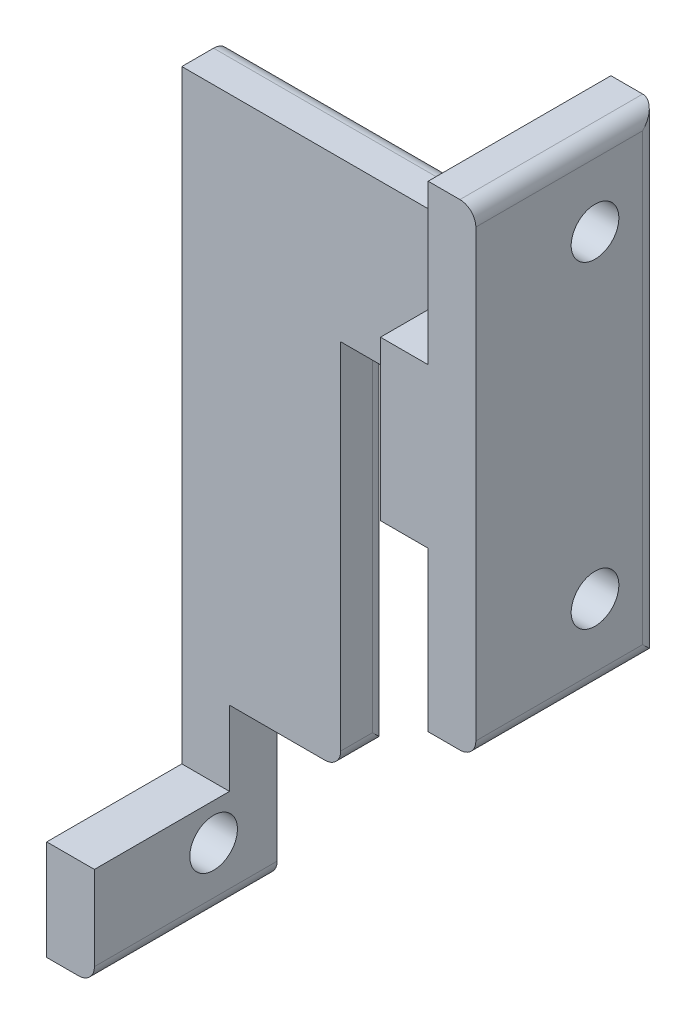
from build123d import *

# Parameters (mm, degrees)
CROQUIS1_W              = 23
CROQUIS1_H              = 33.3
SALIENTE_EXTRUIR2_DEPTH = 7
CROQUIS3_W              = 4
CROQUIS3_H              = 19
CORTAR_EXTRUIR1_DEPTH   = 42.071766458
CROQUIS7_R              = 1.5
SALIENTE_EXTRUIR3_DEPTH = 3
CROQUIS8_W              = 18
CROQUIS8_H              = 10
CROQUIS8_R              = 1.5
SALIENTE_EXTRUIR5_DEPTH = 1
SALIENTE_EXTRUIR6_START = -3
CROQUIS9_W              = 18
CROQUIS9_H              = 10
CROQUIS9_R              = 1.5
SALIENTE_EXTRUIR6_DEPTH = 3
CROQUIS10_W             = 23
CROQUIS10_H             = 10
SALIENTE_EXTRUIR7_DEPTH = 3
CROQUIS11_W             = 19
CROQUIS11_H             = 38
CORTAR_EXTRUIR5_DEPTH   = 57.449003534
CROQUIS14_W             = 7
CROQUIS14_H             = 16
CORTAR_EXTRUIR7_DEPTH   = 1
CROQUIS15_W             = 7
CROQUIS15_H             = 10
CORTAR_EXTRUIR8_DEPTH   = 58.475994989
CROQUIS17_W             = 23
CROQUIS17_H             = 10
CROQUIS17_R             = 1.5
SALIENTE_EXTRUIR8_DEPTH = 3
REDONDEO2_R             = 1
CROQUIS18_W             = 27
CROQUIS18_H             = 18.5
CORTAR_EXTRUIR10_DEPTH  = 67.516839973


with BuildPart() as part:
    # Croquis1 → Saliente-Extruir2 (new body)
    with BuildSketch(Plane(origin=(0, 0, 0), x_dir=(0, 0, -1), z_dir=(1, 0, 0))):
        with Locations((-11.5, -16.65)):
            Rectangle(CROQUIS1_W, CROQUIS1_H)
    extrude(amount=SALIENTE_EXTRUIR2_DEPTH)

    # Croquis3 → Cortar-Extruir1 (cut, through all)
    with BuildSketch(Plane(origin=(0, 0, 0), x_dir=(1, 0, 0), z_dir=(0, 1, 0))):
        with Locations((5, -12.5)):
            Rectangle(CROQUIS3_W, CROQUIS3_H)
    extrude(amount=-CORTAR_EXTRUIR1_DEPTH, mode=Mode.SUBTRACT)



with BuildPart() as body_2:
    # Croquis7 → Saliente-Extruir3 (new body)
    with BuildSketch(Plane.ZY):
        Polygon((-7, 0), (-7, -33.3), (0, -33.3), (0, -44.3), (23, -44.3), (23, -33.3), (30, -33.3), (30, 0), align=None)
        with Locations((-4, -28.3)):
            Circle(CROQUIS7_R, mode=Mode.SUBTRACT)
        with Locations((-4, -15)):
            Circle(CROQUIS7_R, mode=Mode.SUBTRACT)
        with Locations((27, -15)):
            Circle(CROQUIS7_R, mode=Mode.SUBTRACT)
        with Locations((27, -28.3)):
            Circle(CROQUIS7_R, mode=Mode.SUBTRACT)
        with Locations((19, -40.3)):
            Circle(CROQUIS7_R, mode=Mode.SUBTRACT)
        with Locations((4, -40.3)):
            Circle(CROQUIS7_R, mode=Mode.SUBTRACT)
    extrude(amount=SALIENTE_EXTRUIR3_DEPTH)


with BuildPart() as part_1:
    add(part.part)

    add(body_2.part)  # Saliente-Extruir5 merges body 2
    # Croquis8 → Saliente-Extruir5 (add)
    with BuildSketch(Plane.XY.offset(23)):
        with Locations((9, -5)):
            Rectangle(CROQUIS8_W, CROQUIS8_H)
        with Locations((15, -5)):
            Circle(CROQUIS8_R, mode=Mode.SUBTRACT)
        with Locations((3, -5)):
            Circle(CROQUIS8_R, mode=Mode.SUBTRACT)
    extrude(amount=-SALIENTE_EXTRUIR5_DEPTH)

    # Croquis9 → Saliente-Extruir6 (add)
    with BuildSketch(Plane(origin=(0, 0, 0), x_dir=(-1, 0, 0), z_dir=(0, 0, -1)).offset(SALIENTE_EXTRUIR6_START)):
        with Locations((-9, -5)):
            Rectangle(CROQUIS9_W, CROQUIS9_H)
        with Locations(Location((-15, -5, 0), (0, 0, 180))):
            Circle(CROQUIS9_R, mode=Mode.SUBTRACT)
    extrude(amount=SALIENTE_EXTRUIR6_DEPTH)

    # Croquis10 → Saliente-Extruir7 (add)
    with BuildSketch(Plane(origin=(18, 0, 0), x_dir=(0, 0, -1), z_dir=(1, 0, 0))):
        with Locations((-11.5, -5)):
            Rectangle(CROQUIS10_W, CROQUIS10_H)
    extrude(amount=SALIENTE_EXTRUIR7_DEPTH)

    # Croquis11 → Cortar-Extruir5 (cut, through all)
    with BuildSketch(Plane(origin=(3, 0, 0), x_dir=(0, 0, -1), z_dir=(1, 0, 0))):
        with Locations((-12.5, -19)):
            Rectangle(CROQUIS11_W, CROQUIS11_H)
    extrude(amount=-CORTAR_EXTRUIR5_DEPTH, mode=Mode.SUBTRACT)

    # Croquis14 → Cortar-Extruir7 (cut)
    with BuildSketch(Plane.XY.offset(23)):
        with Locations((3.5, -25.3)):
            Rectangle(CROQUIS14_W, CROQUIS14_H)
    extrude(amount=-CORTAR_EXTRUIR7_DEPTH, mode=Mode.SUBTRACT)

    # Croquis15 → Cortar-Extruir8 (cut, through all)
    with BuildSketch(Plane(origin=(0, 0, 0), x_dir=(0, 0, -1), z_dir=(1, 0, 0))):
        with Locations((-26.5, -5)):
            Rectangle(CROQUIS15_W, CROQUIS15_H)
        with Locations((3.5, -5)):
            Rectangle(CROQUIS15_W, CROQUIS15_H)
    extrude(amount=-CORTAR_EXTRUIR8_DEPTH, mode=Mode.SUBTRACT)

    # Croquis17 → Saliente-Extruir8 (add)
    # profile 1 of 3: a face of its own
    with BuildSketch(Plane(origin=(21, 0, 0), x_dir=(0, 0, -1), z_dir=(1, 0, 0))):
        with Locations((-11.5, -15)):
            Rectangle(CROQUIS17_W, CROQUIS17_H)
        with Locations((-4, -15)):
            Circle(CROQUIS17_R, mode=Mode.SUBTRACT)
        with Locations((-19, -15)):
            Circle(CROQUIS17_R, mode=Mode.SUBTRACT)
    # profile 2 of 3: a face of its own
    with BuildSketch(Plane(origin=(21, 0, 0), x_dir=(0, 0, -1), z_dir=(1, 0, 0))):
        with Locations((-11.5, -5)):
            Rectangle(CROQUIS17_W, CROQUIS17_H)
    # profile 3 of 3: a face of its own
    with BuildSketch(Plane(origin=(21, 0, 0), x_dir=(0, 0, -1), z_dir=(1, 0, 0))):
        with Locations((-11.5, 5)):
            Rectangle(CROQUIS17_W, CROQUIS17_H)
        with Locations((-19, 5)):
            Circle(CROQUIS17_R, mode=Mode.SUBTRACT)
        with Locations((-4, 5)):
            Circle(CROQUIS17_R, mode=Mode.SUBTRACT)
    extrude(amount=SALIENTE_EXTRUIR8_DEPTH)

    # Redondeo2
    # the kernel refuses this fillet: 1 mm, written as the material it takes off along each edge
    with BuildSketch(Plane(origin=(0, -44.3, 23), x_dir=(0, 0, -1), z_dir=(0, 1, 0))) as redondeo2_piece_1:
        with BuildLine():
            CenterArc((REDONDEO2_R, REDONDEO2_R), REDONDEO2_R, 180, 90)
            Line((0, REDONDEO2_R), (-REDONDEO2_R * 0.02, REDONDEO2_R))
            Line((-REDONDEO2_R * 0.02, REDONDEO2_R), (-REDONDEO2_R * 0.02, -REDONDEO2_R * 0.02))
            Line((-REDONDEO2_R * 0.02, -REDONDEO2_R * 0.02), (REDONDEO2_R, -REDONDEO2_R * 0.02))
            Line((REDONDEO2_R, -REDONDEO2_R * 0.02), (REDONDEO2_R, 0))
        make_face()
    extrude(amount=11, mode=Mode.SUBTRACT)
    with BuildSketch(Plane(origin=(0, -44.3, 0), x_dir=(0, 1, 0), z_dir=(0, 0, 1)), Plane(origin=(24, 10, 0), x_dir=(-1, 0, 0), z_dir=(0, 0, 1))) as redondeo2_piece_2:
        with BuildLine():
            CenterArc((REDONDEO2_R, REDONDEO2_R), REDONDEO2_R, 180, 90)
            Line((0, REDONDEO2_R), (-REDONDEO2_R * 0.02, REDONDEO2_R))
            Line((-REDONDEO2_R * 0.02, REDONDEO2_R), (-REDONDEO2_R * 0.02, -REDONDEO2_R * 0.02))
            Line((-REDONDEO2_R * 0.02, -REDONDEO2_R * 0.02), (REDONDEO2_R, -REDONDEO2_R * 0.02))
            Line((REDONDEO2_R, -REDONDEO2_R * 0.02), (REDONDEO2_R, 0))
        make_face()
    extrude(amount=23, mode=Mode.SUBTRACT)
    with BuildSketch(Plane(origin=(0, -10, 23), x_dir=(0, -1, 0), z_dir=(0, 0, 1)), Plane(origin=(0, -10, 0), x_dir=(-1, 0, 0), z_dir=(0, 0, -1))) as redondeo2_piece_3:
        with BuildLine():
            CenterArc((REDONDEO2_R, -REDONDEO2_R), REDONDEO2_R, 90, 90)
            Line((0, -REDONDEO2_R), (-REDONDEO2_R * 0.02, -REDONDEO2_R))
            Line((-REDONDEO2_R * 0.02, -REDONDEO2_R), (-REDONDEO2_R * 0.02, REDONDEO2_R * 0.02))
            Line((-REDONDEO2_R * 0.02, REDONDEO2_R * 0.02), (REDONDEO2_R, REDONDEO2_R * 0.02))
            Line((REDONDEO2_R, REDONDEO2_R * 0.02), (REDONDEO2_R, 0))
        make_face()
    extrude(amount=7, mode=Mode.SUBTRACT)
    with BuildSketch(Plane(origin=(0, -33.3, 23), x_dir=(0, 1, 0), z_dir=(0, 0, 1)), Plane(origin=(0, -33.3, -7), x_dir=(0, 1, 0), z_dir=(0, 0, 1))) as redondeo2_piece_4:
        with BuildLine():
            CenterArc((REDONDEO2_R, REDONDEO2_R), REDONDEO2_R, 180, 90)
            Line((0, REDONDEO2_R), (-REDONDEO2_R * 0.02, REDONDEO2_R))
            Line((-REDONDEO2_R * 0.02, REDONDEO2_R), (-REDONDEO2_R * 0.02, -REDONDEO2_R * 0.02))
            Line((-REDONDEO2_R * 0.02, -REDONDEO2_R * 0.02), (REDONDEO2_R, -REDONDEO2_R * 0.02))
            Line((REDONDEO2_R, -REDONDEO2_R * 0.02), (REDONDEO2_R, 0))
        make_face()
    extrude(amount=7, mode=Mode.SUBTRACT)
    with BuildSketch(Plane(origin=(0, -33.3, 30), x_dir=(0, 0, -1), z_dir=(0, 1, 0)), Plane(origin=(0, -10, -7), x_dir=(0, 0, 1), z_dir=(0, -1, 0))) as redondeo2_piece_5:
        with BuildLine():
            CenterArc((REDONDEO2_R, REDONDEO2_R), REDONDEO2_R, 180, 90)
            Line((0, REDONDEO2_R), (-REDONDEO2_R * 0.02, REDONDEO2_R))
            Line((-REDONDEO2_R * 0.02, REDONDEO2_R), (-REDONDEO2_R * 0.02, -REDONDEO2_R * 0.02))
            Line((-REDONDEO2_R * 0.02, -REDONDEO2_R * 0.02), (REDONDEO2_R, -REDONDEO2_R * 0.02))
            Line((REDONDEO2_R, -REDONDEO2_R * 0.02), (REDONDEO2_R, 0))
        make_face()
    extrude(amount=23.3, mode=Mode.SUBTRACT)
    with BuildSketch(Plane(origin=(7, -33.3, 0), x_dir=(-1, 0, 0), z_dir=(0, 0, 1))) as redondeo2_piece_6:
        with BuildLine():
            CenterArc((REDONDEO2_R, -REDONDEO2_R), REDONDEO2_R, 90, 90)
            Line((0, -REDONDEO2_R), (-REDONDEO2_R * 0.02, -REDONDEO2_R))
            Line((-REDONDEO2_R * 0.02, -REDONDEO2_R), (-REDONDEO2_R * 0.02, REDONDEO2_R * 0.02))
            Line((-REDONDEO2_R * 0.02, REDONDEO2_R * 0.02), (REDONDEO2_R, REDONDEO2_R * 0.02))
            Line((REDONDEO2_R, REDONDEO2_R * 0.02), (REDONDEO2_R, 0))
        make_face()
    extrude(amount=3, mode=Mode.SUBTRACT)
    with BuildSketch(Plane(origin=(7, -10, 0), x_dir=(-1, 0, 0), z_dir=(0, -1, 0))) as redondeo2_piece_7:
        with BuildLine():
            CenterArc((REDONDEO2_R, -REDONDEO2_R), REDONDEO2_R, 90, 90)
            Line((0, -REDONDEO2_R), (-REDONDEO2_R * 0.02, -REDONDEO2_R))
            Line((-REDONDEO2_R * 0.02, -REDONDEO2_R), (-REDONDEO2_R * 0.02, REDONDEO2_R * 0.02))
            Line((-REDONDEO2_R * 0.02, REDONDEO2_R * 0.02), (REDONDEO2_R, REDONDEO2_R * 0.02))
            Line((REDONDEO2_R, REDONDEO2_R * 0.02), (REDONDEO2_R, 0))
        make_face()
    extrude(amount=23.3, mode=Mode.SUBTRACT)
    with BuildSketch(Plane(origin=(21, -10, 0), x_dir=(0, 1, 0), z_dir=(-1, 0, 0))) as redondeo2_piece_8:
        with BuildLine():
            CenterArc((REDONDEO2_R, -REDONDEO2_R), REDONDEO2_R, 90, 90)
            Line((0, -REDONDEO2_R), (-REDONDEO2_R * 0.02, -REDONDEO2_R))
            Line((-REDONDEO2_R * 0.02, -REDONDEO2_R), (-REDONDEO2_R * 0.02, REDONDEO2_R * 0.02))
            Line((-REDONDEO2_R * 0.02, REDONDEO2_R * 0.02), (REDONDEO2_R, REDONDEO2_R * 0.02))
            Line((REDONDEO2_R, REDONDEO2_R * 0.02), (REDONDEO2_R, 0))
        make_face()
    extrude(amount=14, mode=Mode.SUBTRACT)
    with BuildSketch(Plane(origin=(21, 0, 0), x_dir=(0, -1, 0), z_dir=(-1, 0, 0))) as redondeo2_piece_9:
        with BuildLine():
            CenterArc((REDONDEO2_R, REDONDEO2_R), REDONDEO2_R, 180, 90)
            Line((0, REDONDEO2_R), (-REDONDEO2_R * 0.02, REDONDEO2_R))
            Line((-REDONDEO2_R * 0.02, REDONDEO2_R), (-REDONDEO2_R * 0.02, -REDONDEO2_R * 0.02))
            Line((-REDONDEO2_R * 0.02, -REDONDEO2_R * 0.02), (REDONDEO2_R, -REDONDEO2_R * 0.02))
            Line((REDONDEO2_R, -REDONDEO2_R * 0.02), (REDONDEO2_R, 0))
        make_face()
    extrude(amount=24, mode=Mode.SUBTRACT)
    with BuildSketch(Plane(origin=(24, 10, 0), x_dir=(-1, 0, 0), z_dir=(0, -1, 0)), Plane(origin=(24, 10, 23), x_dir=(0, 0, -1), z_dir=(0, -1, 0))) as redondeo2_piece_10:
        with BuildLine():
            CenterArc((REDONDEO2_R, -REDONDEO2_R), REDONDEO2_R, 90, 90)
            Line((0, -REDONDEO2_R), (-REDONDEO2_R * 0.02, -REDONDEO2_R))
            Line((-REDONDEO2_R * 0.02, -REDONDEO2_R), (-REDONDEO2_R * 0.02, REDONDEO2_R * 0.02))
            Line((-REDONDEO2_R * 0.02, REDONDEO2_R * 0.02), (REDONDEO2_R, REDONDEO2_R * 0.02))
            Line((REDONDEO2_R, REDONDEO2_R * 0.02), (REDONDEO2_R, 0))
        make_face()
    extrude(amount=30, mode=Mode.SUBTRACT)
    with BuildSketch(Plane(origin=(24, -20, 0), x_dir=(-1, 0, 0), z_dir=(0, 0, 1))) as redondeo2_piece_11:
        with BuildLine():
            CenterArc((REDONDEO2_R, -REDONDEO2_R), REDONDEO2_R, 90, 90)
            Line((0, -REDONDEO2_R), (-REDONDEO2_R * 0.02, -REDONDEO2_R))
            Line((-REDONDEO2_R * 0.02, -REDONDEO2_R), (-REDONDEO2_R * 0.02, REDONDEO2_R * 0.02))
            Line((-REDONDEO2_R * 0.02, REDONDEO2_R * 0.02), (REDONDEO2_R, REDONDEO2_R * 0.02))
            Line((REDONDEO2_R, REDONDEO2_R * 0.02), (REDONDEO2_R, 0))
        make_face()
    extrude(amount=23, mode=Mode.SUBTRACT)
    with BuildSketch(Plane(origin=(0, -46.8, 23), x_dir=(0, 0, -1), z_dir=(0, 1, 0))) as redondeo2_piece_12a_section:
        with BuildLine():
            CenterArc((REDONDEO2_R, REDONDEO2_R), REDONDEO2_R, 180, 90)
            Line((0, REDONDEO2_R), (-REDONDEO2_R * 0.02, REDONDEO2_R))
            Line((-REDONDEO2_R * 0.02, REDONDEO2_R), (-REDONDEO2_R * 0.02, -REDONDEO2_R * 0.02))
            Line((-REDONDEO2_R * 0.02, -REDONDEO2_R * 0.02), (REDONDEO2_R, -REDONDEO2_R * 0.02))
            Line((REDONDEO2_R, -REDONDEO2_R * 0.02), (REDONDEO2_R, 0))
        make_face()
    redondeo2_piece_12a = extrude(amount=13.5, mode=Mode.PRIVATE)
    redondeo2_piece_12a = split(redondeo2_piece_12a, bisect_by=Plane(origin=(-0.226395114, -44.3, 22.773604886), z_dir=(0, -1, 0)), keep=Keep.TOP, mode=Mode.PRIVATE)
    with BuildSketch(Plane(origin=(0, -44.3, 0), x_dir=(0, 1, 0), z_dir=(0, 0, 1))) as redondeo2_piece_12b_section:
        with BuildLine():
            CenterArc((REDONDEO2_R, REDONDEO2_R), REDONDEO2_R, 180, 90)
            Line((0, REDONDEO2_R), (-REDONDEO2_R * 0.02, REDONDEO2_R))
            Line((-REDONDEO2_R * 0.02, REDONDEO2_R), (-REDONDEO2_R * 0.02, -REDONDEO2_R * 0.02))
            Line((-REDONDEO2_R * 0.02, -REDONDEO2_R * 0.02), (REDONDEO2_R, -REDONDEO2_R * 0.02))
            Line((REDONDEO2_R, -REDONDEO2_R * 0.02), (REDONDEO2_R, 0))
        make_face()
    redondeo2_piece_12b = extrude(amount=25.5, mode=Mode.PRIVATE)
    redondeo2_piece_12b = split(redondeo2_piece_12b, bisect_by=Plane(origin=(-0.226395114, -44.073604886, 23), z_dir=(0, 0, 1)), keep=Keep.TOP, mode=Mode.PRIVATE)
    redondeo2_piece_12 = redondeo2_piece_12a & redondeo2_piece_12b
    add(redondeo2_piece_12, mode=Mode.SUBTRACT)
    with BuildSketch(Plane(origin=(0, -33.3, 20.5), x_dir=(0, 1, 0), z_dir=(0, 0, 1))) as redondeo2_piece_13a_section:
        with BuildLine():
            CenterArc((REDONDEO2_R, REDONDEO2_R), REDONDEO2_R, 180, 90)
            Line((0, REDONDEO2_R), (-REDONDEO2_R * 0.02, REDONDEO2_R))
            Line((-REDONDEO2_R * 0.02, REDONDEO2_R), (-REDONDEO2_R * 0.02, -REDONDEO2_R * 0.02))
            Line((-REDONDEO2_R * 0.02, -REDONDEO2_R * 0.02), (REDONDEO2_R, -REDONDEO2_R * 0.02))
            Line((REDONDEO2_R, -REDONDEO2_R * 0.02), (REDONDEO2_R, 0))
        make_face()
    redondeo2_piece_13a = extrude(amount=9.5, mode=Mode.PRIVATE)
    redondeo2_piece_13a = split(redondeo2_piece_13a, bisect_by=Plane(origin=(-0.226395114, -33.073604886, 23), z_dir=(0, 0, -1)), keep=Keep.TOP, mode=Mode.PRIVATE)
    with BuildSketch(Plane(origin=(0, -44.3, 23), x_dir=(0, 0, -1), z_dir=(0, 1, 0))) as redondeo2_piece_13b_section:
        with BuildLine():
            CenterArc((REDONDEO2_R, REDONDEO2_R), REDONDEO2_R, 180, 90)
            Line((0, REDONDEO2_R), (-REDONDEO2_R * 0.02, REDONDEO2_R))
            Line((-REDONDEO2_R * 0.02, REDONDEO2_R), (-REDONDEO2_R * 0.02, -REDONDEO2_R * 0.02))
            Line((-REDONDEO2_R * 0.02, -REDONDEO2_R * 0.02), (REDONDEO2_R, -REDONDEO2_R * 0.02))
            Line((REDONDEO2_R, -REDONDEO2_R * 0.02), (REDONDEO2_R, 0))
        make_face()
    redondeo2_piece_13b = extrude(amount=13.5, mode=Mode.PRIVATE)
    redondeo2_piece_13b = split(redondeo2_piece_13b, bisect_by=Plane(origin=(-0.226395114, -33.3, 22.773604886), z_dir=(0, 1, 0)), keep=Keep.TOP, mode=Mode.PRIVATE)
    redondeo2_piece_13 = redondeo2_piece_13a & redondeo2_piece_13b
    add(redondeo2_piece_13, mode=Mode.SUBTRACT)
    with BuildSketch(Plane(origin=(0, -10, 23), x_dir=(0, -1, 0), z_dir=(0, 0, 1))) as redondeo2_piece_14a_section:
        with BuildLine():
            CenterArc((REDONDEO2_R, -REDONDEO2_R), REDONDEO2_R, 90, 90)
            Line((0, -REDONDEO2_R), (-REDONDEO2_R * 0.02, -REDONDEO2_R))
            Line((-REDONDEO2_R * 0.02, -REDONDEO2_R), (-REDONDEO2_R * 0.02, REDONDEO2_R * 0.02))
            Line((-REDONDEO2_R * 0.02, REDONDEO2_R * 0.02), (REDONDEO2_R, REDONDEO2_R * 0.02))
            Line((REDONDEO2_R, REDONDEO2_R * 0.02), (REDONDEO2_R, 0))
        make_face()
    redondeo2_piece_14a = extrude(amount=9.5, mode=Mode.PRIVATE)
    redondeo2_piece_14a = split(redondeo2_piece_14a, bisect_by=Plane(origin=(-0.226395114, -10.226395114, 30), z_dir=(0, 0, 1)), keep=Keep.TOP, mode=Mode.PRIVATE)
    with BuildSketch(Plane(origin=(0, -33.3, 30), x_dir=(0, 0, -1), z_dir=(0, 1, 0))) as redondeo2_piece_14b_section:
        with BuildLine():
            CenterArc((REDONDEO2_R, REDONDEO2_R), REDONDEO2_R, 180, 90)
            Line((0, REDONDEO2_R), (-REDONDEO2_R * 0.02, REDONDEO2_R))
            Line((-REDONDEO2_R * 0.02, REDONDEO2_R), (-REDONDEO2_R * 0.02, -REDONDEO2_R * 0.02))
            Line((-REDONDEO2_R * 0.02, -REDONDEO2_R * 0.02), (REDONDEO2_R, -REDONDEO2_R * 0.02))
            Line((REDONDEO2_R, -REDONDEO2_R * 0.02), (REDONDEO2_R, 0))
        make_face()
    redondeo2_piece_14b = extrude(amount=25.8, mode=Mode.PRIVATE)
    redondeo2_piece_14b = split(redondeo2_piece_14b, bisect_by=Plane(origin=(-0.226395114, -10, 29.773604886), z_dir=(0, 1, 0)), keep=Keep.TOP, mode=Mode.PRIVATE)
    redondeo2_piece_14 = redondeo2_piece_14a & redondeo2_piece_14b
    add(redondeo2_piece_14, mode=Mode.SUBTRACT)
    with BuildSketch(Plane(origin=(0, -33.3, 23), x_dir=(0, 1, 0), z_dir=(0, 0, 1))) as redondeo2_piece_15a_section:
        with BuildLine():
            CenterArc((REDONDEO2_R, REDONDEO2_R), REDONDEO2_R, 180, 90)
            Line((0, REDONDEO2_R), (-REDONDEO2_R * 0.02, REDONDEO2_R))
            Line((-REDONDEO2_R * 0.02, REDONDEO2_R), (-REDONDEO2_R * 0.02, -REDONDEO2_R * 0.02))
            Line((-REDONDEO2_R * 0.02, -REDONDEO2_R * 0.02), (REDONDEO2_R, -REDONDEO2_R * 0.02))
            Line((REDONDEO2_R, -REDONDEO2_R * 0.02), (REDONDEO2_R, 0))
        make_face()
    redondeo2_piece_15a = extrude(amount=9.5, mode=Mode.PRIVATE)
    redondeo2_piece_15a = split(redondeo2_piece_15a, bisect_by=Plane(origin=(-0.226395114, -33.073604886, 30), z_dir=(0, 0, 1)), keep=Keep.TOP, mode=Mode.PRIVATE)
    with BuildSketch(Plane(origin=(0, -35.8, 30), x_dir=(0, 0, -1), z_dir=(0, 1, 0))) as redondeo2_piece_15b_section:
        with BuildLine():
            CenterArc((REDONDEO2_R, REDONDEO2_R), REDONDEO2_R, 180, 90)
            Line((0, REDONDEO2_R), (-REDONDEO2_R * 0.02, REDONDEO2_R))
            Line((-REDONDEO2_R * 0.02, REDONDEO2_R), (-REDONDEO2_R * 0.02, -REDONDEO2_R * 0.02))
            Line((-REDONDEO2_R * 0.02, -REDONDEO2_R * 0.02), (REDONDEO2_R, -REDONDEO2_R * 0.02))
            Line((REDONDEO2_R, -REDONDEO2_R * 0.02), (REDONDEO2_R, 0))
        make_face()
    redondeo2_piece_15b = extrude(amount=25.8, mode=Mode.PRIVATE)
    redondeo2_piece_15b = split(redondeo2_piece_15b, bisect_by=Plane(origin=(-0.226395114, -33.3, 29.773604886), z_dir=(0, -1, 0)), keep=Keep.TOP, mode=Mode.PRIVATE)
    redondeo2_piece_15 = redondeo2_piece_15a & redondeo2_piece_15b
    add(redondeo2_piece_15, mode=Mode.SUBTRACT)
    with BuildSketch(Plane(origin=(7, -10, 0), x_dir=(-1, 0, 0), z_dir=(0, -1, 0))) as redondeo2_piece_16a_section:
        with BuildLine():
            CenterArc((REDONDEO2_R, -REDONDEO2_R), REDONDEO2_R, 90, 90)
            Line((0, -REDONDEO2_R), (-REDONDEO2_R * 0.02, -REDONDEO2_R))
            Line((-REDONDEO2_R * 0.02, -REDONDEO2_R), (-REDONDEO2_R * 0.02, REDONDEO2_R * 0.02))
            Line((-REDONDEO2_R * 0.02, REDONDEO2_R * 0.02), (REDONDEO2_R, REDONDEO2_R * 0.02))
            Line((REDONDEO2_R, REDONDEO2_R * 0.02), (REDONDEO2_R, 0))
        make_face()
    redondeo2_piece_16a = extrude(amount=25.8, mode=Mode.PRIVATE)
    redondeo2_piece_16a = split(redondeo2_piece_16a, bisect_by=Plane(origin=(6.773604886, -33.3, 0.226395114), z_dir=(0, -1, 0)), keep=Keep.TOP, mode=Mode.PRIVATE)
    with BuildSketch(Plane(origin=(7, -33.3, -2.5), x_dir=(-1, 0, 0), z_dir=(0, 0, 1))) as redondeo2_piece_16b_section:
        with BuildLine():
            CenterArc((REDONDEO2_R, -REDONDEO2_R), REDONDEO2_R, 90, 90)
            Line((0, -REDONDEO2_R), (-REDONDEO2_R * 0.02, -REDONDEO2_R))
            Line((-REDONDEO2_R * 0.02, -REDONDEO2_R), (-REDONDEO2_R * 0.02, REDONDEO2_R * 0.02))
            Line((-REDONDEO2_R * 0.02, REDONDEO2_R * 0.02), (REDONDEO2_R, REDONDEO2_R * 0.02))
            Line((REDONDEO2_R, REDONDEO2_R * 0.02), (REDONDEO2_R, 0))
        make_face()
    redondeo2_piece_16b = extrude(amount=5.5, mode=Mode.PRIVATE)
    redondeo2_piece_16b = split(redondeo2_piece_16b, bisect_by=Plane(origin=(6.773604886, -33.073604886, 0), z_dir=(0, 0, -1)), keep=Keep.TOP, mode=Mode.PRIVATE)
    redondeo2_piece_16 = redondeo2_piece_16a & redondeo2_piece_16b
    add(redondeo2_piece_16, mode=Mode.SUBTRACT)
    with BuildSketch(Plane(origin=(0, -33.3, -9.5), x_dir=(0, 1, 0), z_dir=(0, 0, 1))) as redondeo2_piece_17a_section:
        with BuildLine():
            CenterArc((REDONDEO2_R, REDONDEO2_R), REDONDEO2_R, 180, 90)
            Line((0, REDONDEO2_R), (-REDONDEO2_R * 0.02, REDONDEO2_R))
            Line((-REDONDEO2_R * 0.02, REDONDEO2_R), (-REDONDEO2_R * 0.02, -REDONDEO2_R * 0.02))
            Line((-REDONDEO2_R * 0.02, -REDONDEO2_R * 0.02), (REDONDEO2_R, -REDONDEO2_R * 0.02))
            Line((REDONDEO2_R, -REDONDEO2_R * 0.02), (REDONDEO2_R, 0))
        make_face()
    redondeo2_piece_17a = extrude(amount=9.5, mode=Mode.PRIVATE)
    redondeo2_piece_17a = split(redondeo2_piece_17a, bisect_by=Plane(origin=(-0.226395114, -33.073604886, -7), z_dir=(0, 0, -1)), keep=Keep.TOP, mode=Mode.PRIVATE)
    with BuildSketch(Plane(origin=(0, -10, -7), x_dir=(0, 0, 1), z_dir=(0, -1, 0))) as redondeo2_piece_17b_section:
        with BuildLine():
            CenterArc((REDONDEO2_R, REDONDEO2_R), REDONDEO2_R, 180, 90)
            Line((0, REDONDEO2_R), (-REDONDEO2_R * 0.02, REDONDEO2_R))
            Line((-REDONDEO2_R * 0.02, REDONDEO2_R), (-REDONDEO2_R * 0.02, -REDONDEO2_R * 0.02))
            Line((-REDONDEO2_R * 0.02, -REDONDEO2_R * 0.02), (REDONDEO2_R, -REDONDEO2_R * 0.02))
            Line((REDONDEO2_R, -REDONDEO2_R * 0.02), (REDONDEO2_R, 0))
        make_face()
    redondeo2_piece_17b = extrude(amount=25.8, mode=Mode.PRIVATE)
    redondeo2_piece_17b = split(redondeo2_piece_17b, bisect_by=Plane(origin=(-0.226395114, -33.3, -6.773604886), z_dir=(0, -1, 0)), keep=Keep.TOP, mode=Mode.PRIVATE)
    redondeo2_piece_17 = redondeo2_piece_17a & redondeo2_piece_17b
    add(redondeo2_piece_17, mode=Mode.SUBTRACT)
    with BuildSketch(Plane(origin=(0, -10, 0), x_dir=(-1, 0, 0), z_dir=(0, 0, -1))) as redondeo2_piece_18a_section:
        with BuildLine():
            CenterArc((REDONDEO2_R, -REDONDEO2_R), REDONDEO2_R, 90, 90)
            Line((0, -REDONDEO2_R), (-REDONDEO2_R * 0.02, -REDONDEO2_R))
            Line((-REDONDEO2_R * 0.02, -REDONDEO2_R), (-REDONDEO2_R * 0.02, REDONDEO2_R * 0.02))
            Line((-REDONDEO2_R * 0.02, REDONDEO2_R * 0.02), (REDONDEO2_R, REDONDEO2_R * 0.02))
            Line((REDONDEO2_R, REDONDEO2_R * 0.02), (REDONDEO2_R, 0))
        make_face()
    redondeo2_piece_18a = extrude(amount=9.5, mode=Mode.PRIVATE)
    redondeo2_piece_18a = split(redondeo2_piece_18a, bisect_by=Plane(origin=(-0.226395114, -10.226395114, -7), z_dir=(0, 0, -1)), keep=Keep.TOP, mode=Mode.PRIVATE)
    with BuildSketch(Plane(origin=(0, -7.5, -7), x_dir=(0, 0, 1), z_dir=(0, -1, 0))) as redondeo2_piece_18b_section:
        with BuildLine():
            CenterArc((REDONDEO2_R, REDONDEO2_R), REDONDEO2_R, 180, 90)
            Line((0, REDONDEO2_R), (-REDONDEO2_R * 0.02, REDONDEO2_R))
            Line((-REDONDEO2_R * 0.02, REDONDEO2_R), (-REDONDEO2_R * 0.02, -REDONDEO2_R * 0.02))
            Line((-REDONDEO2_R * 0.02, -REDONDEO2_R * 0.02), (REDONDEO2_R, -REDONDEO2_R * 0.02))
            Line((REDONDEO2_R, -REDONDEO2_R * 0.02), (REDONDEO2_R, 0))
        make_face()
    redondeo2_piece_18b = extrude(amount=25.8, mode=Mode.PRIVATE)
    redondeo2_piece_18b = split(redondeo2_piece_18b, bisect_by=Plane(origin=(-0.226395114, -10, -6.773604886), z_dir=(0, 1, 0)), keep=Keep.TOP, mode=Mode.PRIVATE)
    redondeo2_piece_18 = redondeo2_piece_18a & redondeo2_piece_18b
    add(redondeo2_piece_18, mode=Mode.SUBTRACT)
    with BuildSketch(Plane(origin=(21, -10, 0), x_dir=(0, 1, 0), z_dir=(-1, 0, 0))) as redondeo2_piece_19a_section:
        with BuildLine():
            CenterArc((REDONDEO2_R, -REDONDEO2_R), REDONDEO2_R, 90, 90)
            Line((0, -REDONDEO2_R), (-REDONDEO2_R * 0.02, -REDONDEO2_R))
            Line((-REDONDEO2_R * 0.02, -REDONDEO2_R), (-REDONDEO2_R * 0.02, REDONDEO2_R * 0.02))
            Line((-REDONDEO2_R * 0.02, REDONDEO2_R * 0.02), (REDONDEO2_R, REDONDEO2_R * 0.02))
            Line((REDONDEO2_R, REDONDEO2_R * 0.02), (REDONDEO2_R, 0))
        make_face()
    redondeo2_piece_19a = extrude(amount=16.5, mode=Mode.PRIVATE)
    redondeo2_piece_19a = split(redondeo2_piece_19a, bisect_by=Plane(origin=(7, -9.773604886, 0.226395114), z_dir=(-1, 0, 0)), keep=Keep.TOP, mode=Mode.PRIVATE)
    with BuildSketch(Plane(origin=(7, -7.5, 0), x_dir=(-1, 0, 0), z_dir=(0, -1, 0))) as redondeo2_piece_19b_section:
        with BuildLine():
            CenterArc((REDONDEO2_R, -REDONDEO2_R), REDONDEO2_R, 90, 90)
            Line((0, -REDONDEO2_R), (-REDONDEO2_R * 0.02, -REDONDEO2_R))
            Line((-REDONDEO2_R * 0.02, -REDONDEO2_R), (-REDONDEO2_R * 0.02, REDONDEO2_R * 0.02))
            Line((-REDONDEO2_R * 0.02, REDONDEO2_R * 0.02), (REDONDEO2_R, REDONDEO2_R * 0.02))
            Line((REDONDEO2_R, REDONDEO2_R * 0.02), (REDONDEO2_R, 0))
        make_face()
    redondeo2_piece_19b = extrude(amount=25.8, mode=Mode.PRIVATE)
    redondeo2_piece_19b = split(redondeo2_piece_19b, bisect_by=Plane(origin=(6.773604886, -10, 0.226395114), z_dir=(0, 1, 0)), keep=Keep.TOP, mode=Mode.PRIVATE)
    redondeo2_piece_19 = redondeo2_piece_19a & redondeo2_piece_19b
    add(redondeo2_piece_19, mode=Mode.SUBTRACT)
    with BuildSketch(Plane(origin=(24, 12.5, 0), x_dir=(-1, 0, 0), z_dir=(0, -1, 0))) as redondeo2_piece_20a_section:
        with BuildLine():
            CenterArc((REDONDEO2_R, -REDONDEO2_R), REDONDEO2_R, 90, 90)
            Line((0, -REDONDEO2_R), (-REDONDEO2_R * 0.02, -REDONDEO2_R))
            Line((-REDONDEO2_R * 0.02, -REDONDEO2_R), (-REDONDEO2_R * 0.02, REDONDEO2_R * 0.02))
            Line((-REDONDEO2_R * 0.02, REDONDEO2_R * 0.02), (REDONDEO2_R, REDONDEO2_R * 0.02))
            Line((REDONDEO2_R, REDONDEO2_R * 0.02), (REDONDEO2_R, 0))
        make_face()
    redondeo2_piece_20a = extrude(amount=32.5, mode=Mode.PRIVATE)
    redondeo2_piece_20a = split(redondeo2_piece_20a, bisect_by=Plane(origin=(23.773604886, 10, 0.226395114), z_dir=(0, 1, 0)), keep=Keep.TOP, mode=Mode.PRIVATE)
    with BuildSketch(Plane(origin=(24, 10, -2.5), x_dir=(-1, 0, 0), z_dir=(0, 0, 1))) as redondeo2_piece_20b_section:
        with BuildLine():
            CenterArc((REDONDEO2_R, REDONDEO2_R), REDONDEO2_R, 180, 90)
            Line((0, REDONDEO2_R), (-REDONDEO2_R * 0.02, REDONDEO2_R))
            Line((-REDONDEO2_R * 0.02, REDONDEO2_R), (-REDONDEO2_R * 0.02, -REDONDEO2_R * 0.02))
            Line((-REDONDEO2_R * 0.02, -REDONDEO2_R * 0.02), (REDONDEO2_R, -REDONDEO2_R * 0.02))
            Line((REDONDEO2_R, -REDONDEO2_R * 0.02), (REDONDEO2_R, 0))
        make_face()
    redondeo2_piece_20b = extrude(amount=25.5, mode=Mode.PRIVATE)
    redondeo2_piece_20b = split(redondeo2_piece_20b, bisect_by=Plane(origin=(23.773604886, 9.773604886, 0), z_dir=(0, 0, -1)), keep=Keep.TOP, mode=Mode.PRIVATE)
    redondeo2_piece_20 = redondeo2_piece_20a & redondeo2_piece_20b
    add(redondeo2_piece_20, mode=Mode.SUBTRACT)
    with BuildSketch(Plane(origin=(24, 10, 0), x_dir=(-1, 0, 0), z_dir=(0, 0, 1))) as redondeo2_piece_21a_section:
        with BuildLine():
            CenterArc((REDONDEO2_R, REDONDEO2_R), REDONDEO2_R, 180, 90)
            Line((0, REDONDEO2_R), (-REDONDEO2_R * 0.02, REDONDEO2_R))
            Line((-REDONDEO2_R * 0.02, REDONDEO2_R), (-REDONDEO2_R * 0.02, -REDONDEO2_R * 0.02))
            Line((-REDONDEO2_R * 0.02, -REDONDEO2_R * 0.02), (REDONDEO2_R, -REDONDEO2_R * 0.02))
            Line((REDONDEO2_R, -REDONDEO2_R * 0.02), (REDONDEO2_R, 0))
        make_face()
    redondeo2_piece_21a = extrude(amount=25.5, mode=Mode.PRIVATE)
    redondeo2_piece_21a = split(redondeo2_piece_21a, bisect_by=Plane(origin=(23.773604886, 9.773604886, 23), z_dir=(0, 0, 1)), keep=Keep.TOP, mode=Mode.PRIVATE)
    with BuildSketch(Plane(origin=(24, 12.5, 23), x_dir=(0, 0, -1), z_dir=(0, -1, 0))) as redondeo2_piece_21b_section:
        with BuildLine():
            CenterArc((REDONDEO2_R, -REDONDEO2_R), REDONDEO2_R, 90, 90)
            Line((0, -REDONDEO2_R), (-REDONDEO2_R * 0.02, -REDONDEO2_R))
            Line((-REDONDEO2_R * 0.02, -REDONDEO2_R), (-REDONDEO2_R * 0.02, REDONDEO2_R * 0.02))
            Line((-REDONDEO2_R * 0.02, REDONDEO2_R * 0.02), (REDONDEO2_R, REDONDEO2_R * 0.02))
            Line((REDONDEO2_R, REDONDEO2_R * 0.02), (REDONDEO2_R, 0))
        make_face()
    redondeo2_piece_21b = extrude(amount=32.5, mode=Mode.PRIVATE)
    redondeo2_piece_21b = split(redondeo2_piece_21b, bisect_by=Plane(origin=(23.773604886, 10, 22.773604886), z_dir=(0, 1, 0)), keep=Keep.TOP, mode=Mode.PRIVATE)
    redondeo2_piece_21 = redondeo2_piece_21a & redondeo2_piece_21b
    add(redondeo2_piece_21, mode=Mode.SUBTRACT)
    with BuildSketch(Plane(origin=(24, 10, 0), x_dir=(-1, 0, 0), z_dir=(0, -1, 0))) as redondeo2_piece_22a_section:
        with BuildLine():
            CenterArc((REDONDEO2_R, -REDONDEO2_R), REDONDEO2_R, 90, 90)
            Line((0, -REDONDEO2_R), (-REDONDEO2_R * 0.02, -REDONDEO2_R))
            Line((-REDONDEO2_R * 0.02, -REDONDEO2_R), (-REDONDEO2_R * 0.02, REDONDEO2_R * 0.02))
            Line((-REDONDEO2_R * 0.02, REDONDEO2_R * 0.02), (REDONDEO2_R, REDONDEO2_R * 0.02))
            Line((REDONDEO2_R, REDONDEO2_R * 0.02), (REDONDEO2_R, 0))
        make_face()
    redondeo2_piece_22a = extrude(amount=32.5, mode=Mode.PRIVATE)
    redondeo2_piece_22a = split(redondeo2_piece_22a, bisect_by=Plane(origin=(23.773604886, -20, 0.226395114), z_dir=(0, -1, 0)), keep=Keep.TOP, mode=Mode.PRIVATE)
    with BuildSketch(Plane(origin=(24, -20, -2.5), x_dir=(-1, 0, 0), z_dir=(0, 0, 1))) as redondeo2_piece_22b_section:
        with BuildLine():
            CenterArc((REDONDEO2_R, -REDONDEO2_R), REDONDEO2_R, 90, 90)
            Line((0, -REDONDEO2_R), (-REDONDEO2_R * 0.02, -REDONDEO2_R))
            Line((-REDONDEO2_R * 0.02, -REDONDEO2_R), (-REDONDEO2_R * 0.02, REDONDEO2_R * 0.02))
            Line((-REDONDEO2_R * 0.02, REDONDEO2_R * 0.02), (REDONDEO2_R, REDONDEO2_R * 0.02))
            Line((REDONDEO2_R, REDONDEO2_R * 0.02), (REDONDEO2_R, 0))
        make_face()
    redondeo2_piece_22b = extrude(amount=25.5, mode=Mode.PRIVATE)
    redondeo2_piece_22b = split(redondeo2_piece_22b, bisect_by=Plane(origin=(23.773604886, -19.773604886, 0), z_dir=(0, 0, -1)), keep=Keep.TOP, mode=Mode.PRIVATE)
    redondeo2_piece_22 = redondeo2_piece_22a & redondeo2_piece_22b
    add(redondeo2_piece_22, mode=Mode.SUBTRACT)
    with BuildSketch(Plane(origin=(24, -20, 0), x_dir=(-1, 0, 0), z_dir=(0, 0, 1))) as redondeo2_piece_23a_section:
        with BuildLine():
            CenterArc((REDONDEO2_R, -REDONDEO2_R), REDONDEO2_R, 90, 90)
            Line((0, -REDONDEO2_R), (-REDONDEO2_R * 0.02, -REDONDEO2_R))
            Line((-REDONDEO2_R * 0.02, -REDONDEO2_R), (-REDONDEO2_R * 0.02, REDONDEO2_R * 0.02))
            Line((-REDONDEO2_R * 0.02, REDONDEO2_R * 0.02), (REDONDEO2_R, REDONDEO2_R * 0.02))
            Line((REDONDEO2_R, REDONDEO2_R * 0.02), (REDONDEO2_R, 0))
        make_face()
    redondeo2_piece_23a = extrude(amount=25.5, mode=Mode.PRIVATE)
    redondeo2_piece_23a = split(redondeo2_piece_23a, bisect_by=Plane(origin=(23.773604886, -19.773604886, 23), z_dir=(0, 0, 1)), keep=Keep.TOP, mode=Mode.PRIVATE)
    with BuildSketch(Plane(origin=(24, 10, 23), x_dir=(0, 0, -1), z_dir=(0, -1, 0))) as redondeo2_piece_23b_section:
        with BuildLine():
            CenterArc((REDONDEO2_R, -REDONDEO2_R), REDONDEO2_R, 90, 90)
            Line((0, -REDONDEO2_R), (-REDONDEO2_R * 0.02, -REDONDEO2_R))
            Line((-REDONDEO2_R * 0.02, -REDONDEO2_R), (-REDONDEO2_R * 0.02, REDONDEO2_R * 0.02))
            Line((-REDONDEO2_R * 0.02, REDONDEO2_R * 0.02), (REDONDEO2_R, REDONDEO2_R * 0.02))
            Line((REDONDEO2_R, REDONDEO2_R * 0.02), (REDONDEO2_R, 0))
        make_face()
    redondeo2_piece_23b = extrude(amount=32.5, mode=Mode.PRIVATE)
    redondeo2_piece_23b = split(redondeo2_piece_23b, bisect_by=Plane(origin=(23.773604886, -20, 22.773604886), z_dir=(0, -1, 0)), keep=Keep.TOP, mode=Mode.PRIVATE)
    redondeo2_piece_23 = redondeo2_piece_23a & redondeo2_piece_23b
    add(redondeo2_piece_23, mode=Mode.SUBTRACT)

    # Croquis18 → Cortar-Extruir10 (cut, through all)
    with BuildSketch(Plane(origin=(0, -44.3, 0), x_dir=(-1, 0, 0), z_dir=(0, -1, 0))):
        with Locations((-10.5, -20.75)):
            Rectangle(CROQUIS18_W, CROQUIS18_H)
    extrude(amount=-CORTAR_EXTRUIR10_DEPTH, mode=Mode.SUBTRACT)


solid = part_1.part
